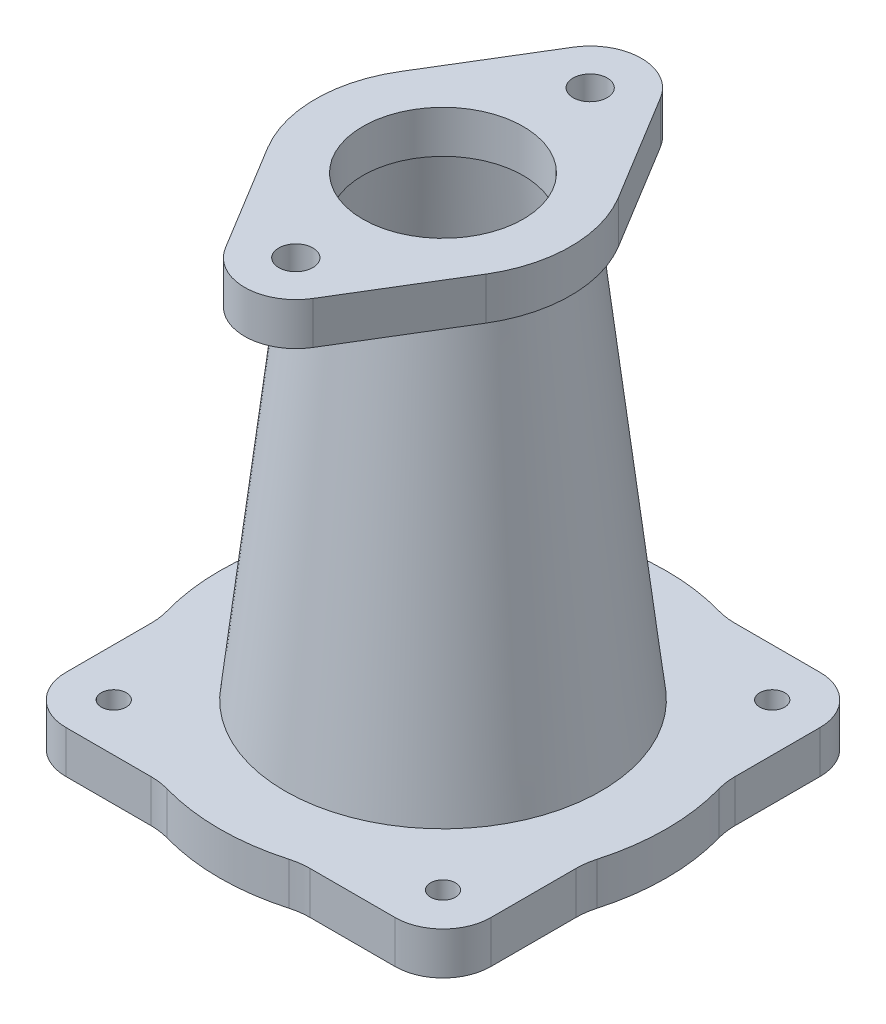
from build123d import *

# Parameters (mm, degrees)
SKETCH2_R           = 22.1742
SKETCH2_R_2         = 1.8669
BOSS_EXTRUDE1_DEPTH = 6.35
SKETCH3_R           = 12
SKETCH3_R_2         = 2.5527
BOSS_EXTRUDE2_DEPTH = 6.35


with BuildPart() as part:
    # Sketch1 → Revolve1 (revolve)
    with BuildSketch(Plane(origin=(0, 0, 0), x_dir=(0, 0, -1), z_dir=(1, 0, 0))):
        Polygon((12, 74.584233381), (15.834649682, 74.584233381), (24.332449682, 0), (20.4978, 0), align=None)
    revolve(axis=Axis((0, 0, 0), (0, 1, 0)))

    # Sketch2 → Boss-Extrude1 (add)
    with BuildSketch(Plane.XZ):
        with BuildLine():
            Line((-31.75, 11.87908334), (-31.75, 24.60625))
            ThreePointArc((-31.75, 24.60625), (-29.657644068, 29.657644068), (-24.60625, 31.75))
            Line((-24.60625, 31.75), (-11.87908334, 31.75))
            ThreePointArc((-11.87908334, 31.75), (-10.480451772, 31.846728676), (-9.108451657, 32.135072886))
            ThreePointArc((-9.108451657, 32.135072886), (0, 33.401), (9.108451657, 32.135072886))
            ThreePointArc((9.108451657, 32.135072886), (10.480451772, 31.846728676), (11.87908334, 31.75))
            Line((11.87908334, 31.75), (24.60625, 31.75))
            ThreePointArc((24.60625, 31.75), (29.657644068, 29.657644068), (31.75, 24.60625))
            Line((31.75, 24.60625), (31.75, 11.87908334))
            ThreePointArc((31.75, 11.87908334), (31.846728676, 10.480451772), (32.135072886, 9.108451657))
            ThreePointArc((32.135072886, 9.108451657), (33.401, 0), (32.135072886, -9.108451657))
            ThreePointArc((32.135072886, -9.108451657), (31.846728676, -10.480451772), (31.75, -11.87908334))
            Line((31.75, -11.87908334), (31.75, -24.60625))
            ThreePointArc((31.75, -24.60625), (29.657644068, -29.657644068), (24.60625, -31.75))
            Line((24.60625, -31.75), (11.87908334, -31.75))
            ThreePointArc((11.87908334, -31.75), (10.480451772, -31.846728676), (9.108451657, -32.135072886))
            ThreePointArc((9.108451657, -32.135072886), (0, -33.401), (-9.108451657, -32.135072886))
            ThreePointArc((-9.108451657, -32.135072886), (-10.480451772, -31.846728676), (-11.87908334, -31.75))
            Line((-11.87908334, -31.75), (-24.60625, -31.75))
            ThreePointArc((-24.60625, -31.75), (-29.657644068, -29.657644068), (-31.75, -24.60625))
            Line((-31.75, -24.60625), (-31.75, -11.87908334))
            ThreePointArc((-31.75, -11.87908334), (-31.846728676, -10.480451772), (-32.135072886, -9.108451657))
            ThreePointArc((-32.135072886, -9.108451657), (-33.401, 0), (-32.135072886, 9.108451657))
            ThreePointArc((-32.135072886, 9.108451657), (-31.846728676, 10.480451772), (-31.75, 11.87908334))
        make_face()
        Circle(SKETCH2_R, mode=Mode.SUBTRACT)
        with Locations((24.60625, 24.60625)):
            Circle(SKETCH2_R_2, mode=Mode.SUBTRACT)
        with Locations((24.60625, -24.60625)):
            Circle(SKETCH2_R_2, mode=Mode.SUBTRACT)
        with Locations((-24.60625, -24.60625)):
            Circle(SKETCH2_R_2, mode=Mode.SUBTRACT)
        with Locations((-24.60625, 24.60625)):
            Circle(SKETCH2_R_2, mode=Mode.SUBTRACT)
    extrude(amount=-BOSS_EXTRUDE1_DEPTH)

    # Sketch3 → Boss-Extrude2 (add)
    with BuildSketch(Plane(origin=(0, 74.584233381, 0), x_dir=(1, 0, 0), z_dir=(0, 1, 0))):
        with BuildLine():
            Line((6.543408506, -25.978731045), (16.309689859, -9.917135591))
            ThreePointArc((16.309689859, -9.917135591), (19.0881, 0), (16.309689859, 9.917135591))
            Line((16.309689859, 9.917135591), (6.543408506, 25.978731045))
            ThreePointArc((6.543408506, 25.978731045), (0, 29.6581), (-6.543408506, 25.978731045))
            Line((-6.543408506, 25.978731045), (-16.309689859, 9.917135591))
            ThreePointArc((-16.309689859, 9.917135591), (-19.0881, 0), (-16.309689859, -9.917135591))
            Line((-16.309689859, -9.917135591), (-6.543408506, -25.978731045))
            ThreePointArc((-6.543408506, -25.978731045), (0, -29.6581), (6.543408506, -25.978731045))
        make_face()
        Circle(SKETCH3_R, mode=Mode.SUBTRACT)
        with Locations((0, 22)):
            Circle(SKETCH3_R_2, mode=Mode.SUBTRACT)
        with Locations((0, -22)):
            Circle(SKETCH3_R_2, mode=Mode.SUBTRACT)
    extrude(amount=-BOSS_EXTRUDE2_DEPTH)


solid = part.part
